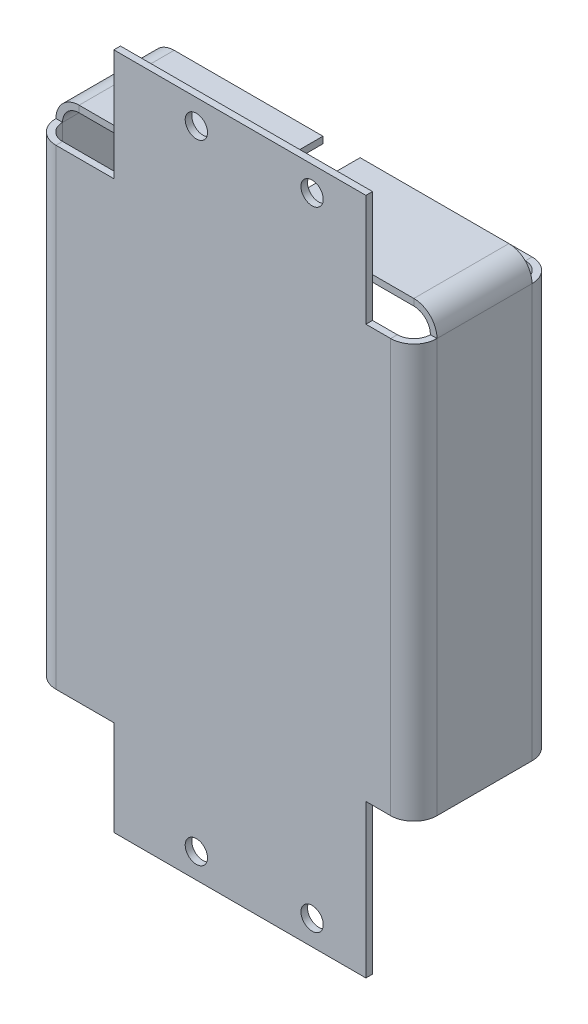
from build123d import *

# Parameters (mm, degrees)
SKETCH1_R                      = 1.35
BASE_FLANGE1_DEPTH             = 0.8
EDGE_FLANGE1_STRIP_W           = 7.2
EDGE_FLANGE1_STRIP_H           = 0.8
EDGE_FLANGE1_STRIP_CUT_DEPTH   = 50
EDGE_FLANGE1_STRIP_2_W         = 7.2
EDGE_FLANGE1_STRIP_2_H         = 0.8
EDGE_FLANGE1_STRIP_CUT_2_DEPTH = 57
EDGE_FLANGE1_DEPTH             = 50
EDGE_FLANGE1_BEND_DEPTH        = 57
EDGE_FLANGE4_DEPTH             = 11.5
EDGE_FLANGE4_BEND_DEPTH        = 11.5
EDGE_FLANGE5_DEPTH             = 50
EDGE_FLANGE5_BEND_DEPTH        = 57


# Sheet-metal steps are written as plain solids
with BuildPart() as part:
    # Sketch1 → Base-Flange1 (new body)
    with BuildSketch(Plane.XY):
        Polygon((16.25, 0), (16.25, -18.5), (-14.25, -18.5), (-14.25, -7), (-23.25, -7), (-23.25, 50), (-14.25, 50), (-14.25, 63.5), (16.25, 63.5), (16.25, 50), (21.25, 50), (21.25, 0), align=None)
        with Locations((9.737756115, -15.5)):
            Circle(SKETCH1_R, mode=Mode.SUBTRACT)
        with Locations((-4.262243885, -15.5)):
            Circle(SKETCH1_R, mode=Mode.SUBTRACT)
        with Locations((9.737756115, 60.5)):
            Circle(SKETCH1_R, mode=Mode.SUBTRACT)
        with Locations((-4.262243885, 60.5)):
            Circle(SKETCH1_R, mode=Mode.SUBTRACT)
    extrude(amount=BASE_FLANGE1_DEPTH)

    # Edge-Flange1 strip (across the edge) → Edge-Flange1 strip cut (cut)
    with BuildSketch(Plane(origin=(21.25, 50, 0), x_dir=(-1, 0, 0), z_dir=(0, -1, 0))):
        with Locations((-1.6, -0.4)):
            Rectangle(EDGE_FLANGE1_STRIP_W, EDGE_FLANGE1_STRIP_H)
    extrude(amount=EDGE_FLANGE1_STRIP_CUT_DEPTH, mode=Mode.SUBTRACT)

    # Edge-Flange1 strip 2 (across the edge) → Edge-Flange1 strip cut 2 (cut)
    with BuildSketch(Plane(origin=(-23.25, -7, 0), x_dir=(1, 0, 0), z_dir=(0, 1, 0))):
        with Locations((-1.6, -0.4)):
            Rectangle(EDGE_FLANGE1_STRIP_2_W, EDGE_FLANGE1_STRIP_2_H)
    extrude(amount=EDGE_FLANGE1_STRIP_CUT_2_DEPTH, mode=Mode.SUBTRACT)

    # Edge-Flange1 section (across the edge) → Edge-Flange1 (add)
    with BuildSketch(Plane(origin=(21.25, 50, 0), x_dir=(-1, 0, 0), z_dir=(0, -1, 0))):
        with BuildLine():
            Line((-0.8, 2), (-0.8, 13.5))
            Line((-0.8, 13.5), (0, 13.5))
            Line((0, 13.5), (0, 2))
            ThreePointArc((0, 2), (0.585786438, 0.585786438), (2, 0))
            Line((2, 0), (2, -0.8))
            ThreePointArc((2, -0.8), (0.020101013, 0.020101013), (-0.8, 2))
        make_face()
    extrude(amount=EDGE_FLANGE1_DEPTH)

    # Edge-Flange1 section 2 (across the edge) → Edge-Flange1 bend (add)
    with BuildSketch(Plane(origin=(-23.25, -7, 0), x_dir=(1, 0, 0), z_dir=(0, 1, 0))):
        with BuildLine():
            Line((-0.8, 2), (-0.8, 13.5))
            Line((-0.8, 13.5), (0, 13.5))
            Line((0, 13.5), (0, 2))
            ThreePointArc((0, 2), (0.585786438, 0.585786438), (2, 0))
            Line((2, 0), (2, -0.8))
            ThreePointArc((2, -0.8), (0.020101013, 0.020101013), (-0.8, 2))
        make_face()
    extrude(amount=EDGE_FLANGE1_BEND_DEPTH)

    # Edge-Flange4 section (across the edge) → Edge-Flange4 (add)
    with BuildSketch(Plane(origin=(21.25, 52, -2), x_dir=(0, -1, 0), z_dir=(0, 0, -1))):
        with BuildLine():
            Line((-0.8, 2), (-0.8, 20))
            Line((-0.8, 20), (0, 20))
            Line((0, 20), (0, 2))
            ThreePointArc((0, 2), (0.585786438, 0.585786438), (2, 0))
            Line((2, 0), (2, -0.8))
            ThreePointArc((2, -0.8), (0.020101013, 0.020101013), (-0.8, 2))
        make_face()
    extrude(amount=EDGE_FLANGE4_DEPTH)

    # Edge-Flange4 section 2 (across the edge) → Edge-Flange4 bend (add)
    with BuildSketch(Plane(origin=(-23.25, 52, -13.5), x_dir=(0, -1, 0), z_dir=(0, 0, 1))):
        with BuildLine():
            Line((-0.8, 2), (-0.8, 20))
            Line((-0.8, 20), (0, 20))
            Line((0, 20), (0, 2))
            ThreePointArc((0, 2), (0.585786438, 0.585786438), (2, 0))
            Line((2, 0), (2, -0.8))
            ThreePointArc((2, -0.8), (0.020101013, 0.020101013), (-0.8, 2))
        make_face()
    extrude(amount=EDGE_FLANGE4_BEND_DEPTH)

    # Edge-Flange5 section (across the edge) → Edge-Flange5 (add)
    with BuildSketch(Plane(origin=(21.25, 50, -15.5), x_dir=(0, 0, 1), z_dir=(0, -1, 0))):
        with BuildLine():
            Line((-0.8, 2), (-0.8, 10))
            Line((-0.8, 10), (0, 10))
            Line((0, 10), (0, 2))
            ThreePointArc((0, 2), (0.585786438, 0.585786438), (2, 0))
            Line((2, 0), (2, -0.8))
            ThreePointArc((2, -0.8), (0.020101013, 0.020101013), (-0.8, 2))
        make_face()
    extrude(amount=EDGE_FLANGE5_DEPTH)

    # Edge-Flange5 section 2 (across the edge) → Edge-Flange5 bend (add)
    with BuildSketch(Plane(origin=(-23.25, -7, -15.5), x_dir=(0, 0, 1), z_dir=(0, 1, 0))):
        with BuildLine():
            Line((-0.8, 2), (-0.8, 10))
            Line((-0.8, 10), (0, 10))
            Line((0, 10), (0, 2))
            ThreePointArc((0, 2), (0.585786438, 0.585786438), (2, 0))
            Line((2, 0), (2, -0.8))
            ThreePointArc((2, -0.8), (0.020101013, 0.020101013), (-0.8, 2))
        make_face()
    extrude(amount=EDGE_FLANGE5_BEND_DEPTH)


solid = part.part
